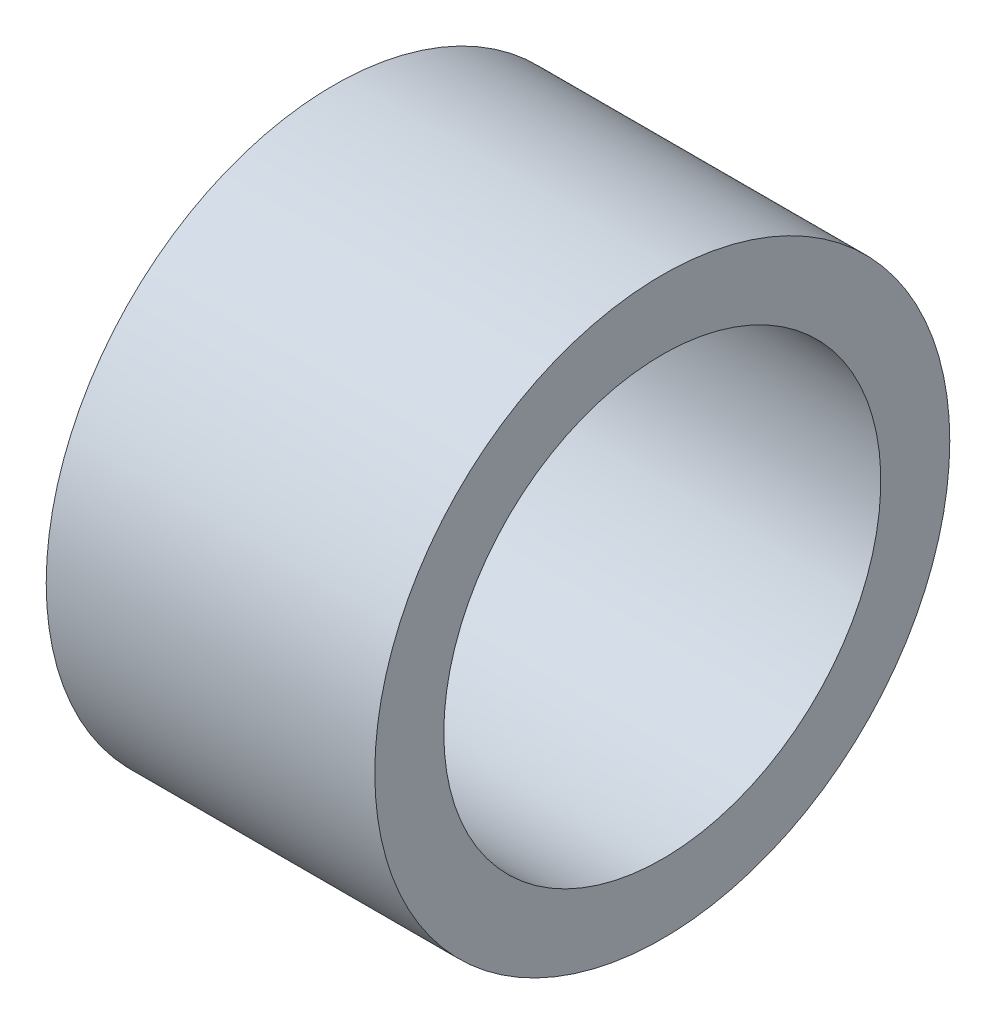
from build123d import *

# Parameters (mm, degrees)
SKETCH1_W = 6.35
SKETCH1_H = 1.3335


with BuildPart() as part:
    # Sketch1 → Revolve1 (revolve)
    with BuildSketch(Plane.XY):
        with Locations((34.925, 4.8895)):
            Rectangle(SKETCH1_W, SKETCH1_H)
    revolve(axis=Axis((0, 0, 0), (1, 0, 0)))


solid = part.part
